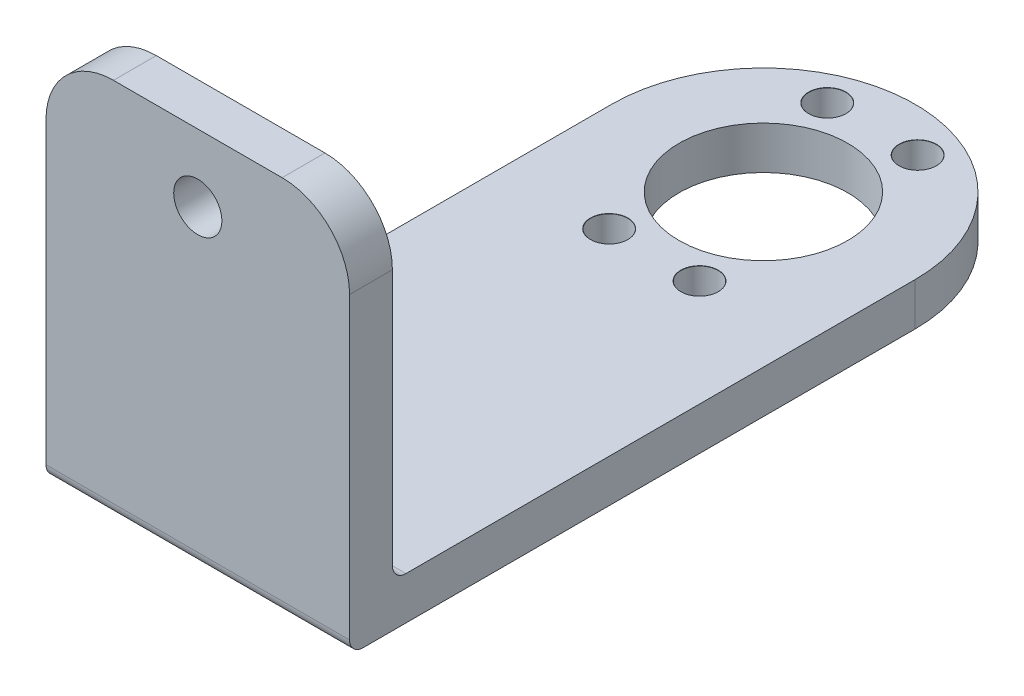
from build123d import *

# Parameters (mm, degrees)
BOSS_EXTRUDE1_DEPTH               = 6.35
M5_CLEARANCE_HOLE1_D              = 5.5
M5_CLEARANCE_HOLE1_CSINK_D        = 5.55
M5_CLEARANCE_HOLE1_CSINK_ANGLE    = 90
SKETCH5_R                         = 12.5
CUT_EXTRUDE1_DEPTH                = 81.949505866
SKETCH12_W                        = 45
SKETCH12_H                        = 56.35
BOSS_EXTRUDE2_DEPTH               = 6.35
F_1_4_CLEARANCE_HOLE1_D           = 7.14248
F_1_4_CLEARANCE_HOLE1_CSINK_D     = 8.41248
F_1_4_CLEARANCE_HOLE1_CSINK_ANGLE = 90
FILLET1_R                         = 10
FILLET2_R                         = 2


with BuildPart() as part:
    # Sketch1 → Boss-Extrude1 (new body)
    with BuildSketch(Plane(origin=(0, 0, 0), x_dir=(1, 0, 0), z_dir=(0, 1, 0))):
        with BuildLine():
            Line((-22.5, -77.5), (22.5, -77.5))
            Line((22.5, -77.5), (22.5, 3.34e-07))
            ThreePointArc((22.5, 3.34e-07), (0, 22.5), (-22.5, 3.34e-07))
            Line((-22.5, 3.34e-07), (-22.5, -77.5))
        make_face()
    extrude(amount=BOSS_EXTRUDE1_DEPTH)

    # M5 Clearance Hole1 (through all)
    with Locations(Plane(origin=(0, 6.35, 0), x_dir=(1, 0, 0), z_dir=(0, 1, 0))):
        with Locations((-6.696960066, -16.167891819), (6.696960066, -16.167891819), (6.696960066, 16.167891819), (-6.696960066, 16.167891819)):
            CounterSinkHole(M5_CLEARANCE_HOLE1_D / 2, M5_CLEARANCE_HOLE1_CSINK_D / 2, counter_sink_angle=M5_CLEARANCE_HOLE1_CSINK_ANGLE)

    # Sketch5 → Cut-Extrude1 (cut, through all)
    with BuildSketch(Plane(origin=(0, 6.35, 0), x_dir=(1, 0, 0), z_dir=(0, 1, 0))):
        Circle(SKETCH5_R)
    extrude(amount=-CUT_EXTRUDE1_DEPTH, mode=Mode.SUBTRACT)

    # Sketch12 → Boss-Extrude2 (add)
    with BuildSketch(Plane.XY.offset(77.5)):
        with Locations((0, 28.175)):
            Rectangle(SKETCH12_W, SKETCH12_H)
    extrude(amount=BOSS_EXTRUDE2_DEPTH)

    # 1/4 Clearance Hole1 (through all)
    with Locations(Plane(origin=(0, 0, 77.5), x_dir=(-1, 0, 0), z_dir=(0, 0, -1))):
        with Locations((0, 46.35)):
            CounterSinkHole(F_1_4_CLEARANCE_HOLE1_D / 2, F_1_4_CLEARANCE_HOLE1_CSINK_D / 2, counter_sink_angle=F_1_4_CLEARANCE_HOLE1_CSINK_ANGLE)

    # Fillet1
    fillet1_edges = [part.edges().sort_by_distance(p)[0] for p in [
        (-22.5, 56.35, 80.675),
        (22.5, 56.35, 80.675),
    ]]
    fillet(fillet1_edges, radius=FILLET1_R)

    # Fillet2
    fillet2_edges = [part.edges().sort_by_distance(p)[0] for p in [
        (0, 0, 83.85),
        (0, 6.35, 77.5),
    ]]
    fillet(fillet2_edges, radius=FILLET2_R)


solid = part.part
